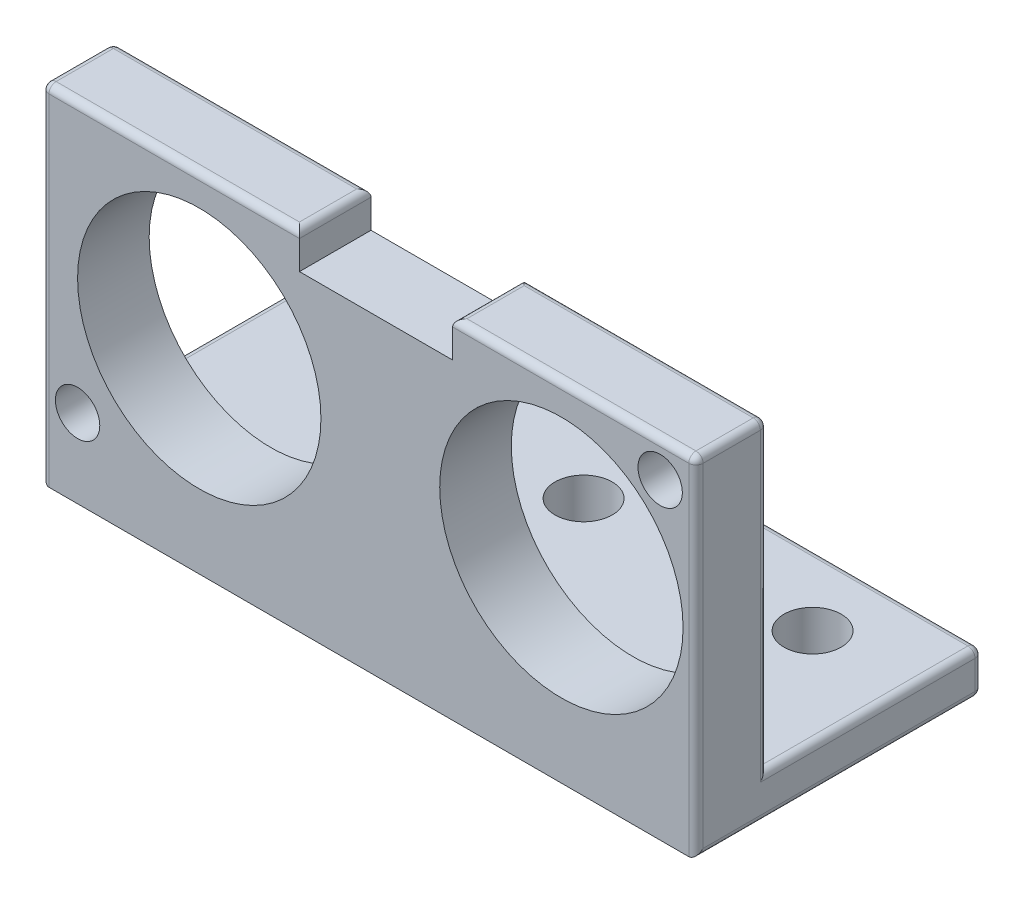
from build123d import *

# Parameters (mm, degrees)
SKETCH_1_W          = 45.7
SKETCH_1_H          = 21.3
EXTRUDE_1_DEPTH     = 5
SKETCH_2_R          = 1.55
SKETCH_2_R_2        = 8.5
CUT_EXTRUDE_1_DEPTH = 13.95
SKETCH_7_W          = 45.7
SKETCH_7_H          = 20
EXTRUDE_3_DEPTH     = 3
SKETCH_3_W          = 10.7
SKETCH_3_H          = 2.5
CUT_EXTRUDE_2_DEPTH = 13.95
FILLET_4_R          = 0.5
SKETCH_11_R         = 2
CUT_EXTRUDE_4_DEPTH = 3
FILLET_5_R          = 0.5


with BuildPart() as part:
    # 草圖1 → 填料-伸長1 (new body)
    with BuildSketch(Plane.XY):
        Rectangle(SKETCH_1_W, SKETCH_1_H)
    extrude(amount=EXTRUDE_1_DEPTH)

    # 草圖2 → 除料-伸長1 (cut)
    with BuildSketch(Plane.XY.offset(5)):
        with Locations((-20.35, -8.15)):
            Circle(SKETCH_2_R)
        with Locations((20.35, 8.15)):
            Circle(SKETCH_2_R)
        with Locations((-11.85, 0)):
            Circle(SKETCH_2_R_2)
        with Locations((13.45, 0)):
            Circle(SKETCH_2_R_2)
    extrude(amount=-CUT_EXTRUDE_1_DEPTH, mode=Mode.SUBTRACT)

    # 草圖7 → 填料-伸長3 (add)
    with BuildSketch(Plane.XZ.offset(10.65)):
        with Locations((0, -5)):
            Rectangle(SKETCH_7_W, SKETCH_7_H)
    extrude(amount=EXTRUDE_3_DEPTH)

    # 草圖3 → 除料-伸長2 (cut)
    with BuildSketch(Plane.XY.offset(5)):
        with Locations((0.5, 9.4)):
            Rectangle(SKETCH_3_W, SKETCH_3_H)
    extrude(amount=-CUT_EXTRUDE_2_DEPTH, mode=Mode.SUBTRACT)

    # 圓角4
    fillet_4_edges = [part.edges().sort_by_distance(p)[0] for p in [
        (14.35, 10.65, 5),
        (5.85, 10.65, 2.5),
        (14.35, 10.65, 0),
        (-13.85, 10.65, 0),
        (-4.85, 10.65, 2.5),
        (-13.85, 10.65, 5),
        (-22.85, 10.65, 2.5),
        (-22.85, -1.5, 5),
        (-22.85, -13.65, -5),
        (-22.85, -12.15, -15),
        (-22.85, -10.65, -7.5),
        (-22.85, 0, 0),
        (22.85, -10.65, -7.5),
        (22.85, -12.15, -15),
        (22.85, -13.65, -5),
        (22.85, -1.5, 5),
        (22.85, 10.65, 2.5),
        (22.85, 0, 0),
    ]]
    fillet(fillet_4_edges, radius=FILLET_4_R)

    # 草圖11 → 除料-伸長4 (cut)
    with BuildSketch(Plane(origin=(0, -10.65, 0), x_dir=(1, 0, 0), z_dir=(0, 1, 0))):
        with Locations(Location((0, 10, 0), (0, 0, 270))):
            Circle(SKETCH_11_R)
        with Locations(Location((16, 10, 0), (0, 0, 270))):
            Circle(SKETCH_11_R)
        with Locations(Location((-16, 10, 0), (0, 0, 270))):
            Circle(SKETCH_11_R)
    extrude(amount=-CUT_EXTRUDE_4_DEPTH, mode=Mode.SUBTRACT)

    # 圓角5
    # the kernel refuses this fillet: 0.5 mm, written as the material it takes off along each edge
    with BuildSketch(Plane(origin=(-22.35, -13.15, -14.5), x_dir=(0, 0, -1), z_dir=(0, -1, 0))) as fillet_5_piece_1_section:
        Polygon((0, 0), (FILLET_5_R, 0), (FILLET_5_R, -FILLET_5_R), (0, -FILLET_5_R), align=None)
    fillet_5_piece_1 = extrude(amount=FILLET_5_R, mode=Mode.PRIVATE)
    fillet_5_piece_1 = fillet_5_piece_1 - Plane(origin=(-22.35, -13.15, -14.5), x_dir=(0.7071067811865475, 0, 0.7071067811865475), z_dir=(0, -1, 0)) * Sphere(FILLET_5_R, mode=Mode.PRIVATE)
    add(fillet_5_piece_1, mode=Mode.SUBTRACT)
    with BuildSketch(Plane(origin=(-22.35, -11.15, -14.5), x_dir=(0, 0, -1), z_dir=(0, 1, 0))) as fillet_5_piece_2_section:
        Polygon((0, 0), (FILLET_5_R, 0), (FILLET_5_R, FILLET_5_R), (0, FILLET_5_R), align=None)
    fillet_5_piece_2 = extrude(amount=FILLET_5_R, mode=Mode.PRIVATE)
    fillet_5_piece_2 = fillet_5_piece_2 - Plane(origin=(-22.35, -11.15, -14.5), x_dir=(0.7071067811865475, 0, 0.7071067811865475), z_dir=(0, 1, 0)) * Sphere(FILLET_5_R, mode=Mode.PRIVATE)
    add(fillet_5_piece_2, mode=Mode.SUBTRACT)
    with BuildSketch(Plane(origin=(22.35, -11.15, -14.5), x_dir=(0, 0, -1), z_dir=(0, 1, 0))) as fillet_5_piece_3_section:
        Polygon((0, 0), (FILLET_5_R, 0), (FILLET_5_R, -FILLET_5_R), (0, -FILLET_5_R), align=None)
    fillet_5_piece_3 = extrude(amount=FILLET_5_R, mode=Mode.PRIVATE)
    fillet_5_piece_3 = fillet_5_piece_3 - Plane(origin=(22.35, -11.15, -14.5), x_dir=(-0.7071067811865475, 0, 0.7071067811865475), z_dir=(0, 1, 0)) * Sphere(FILLET_5_R, mode=Mode.PRIVATE)
    add(fillet_5_piece_3, mode=Mode.SUBTRACT)
    with BuildSketch(Plane(origin=(22.35, -13.15, -14.5), x_dir=(0, 0, -1), z_dir=(0, -1, 0))) as fillet_5_piece_4_section:
        Polygon((0, 0), (FILLET_5_R, 0), (FILLET_5_R, FILLET_5_R), (0, FILLET_5_R), align=None)
    fillet_5_piece_4 = extrude(amount=FILLET_5_R, mode=Mode.PRIVATE)
    fillet_5_piece_4 = fillet_5_piece_4 - Plane(origin=(22.35, -13.15, -14.5), x_dir=(-0.7071067811865475, 0, 0.7071067811865475), z_dir=(0, -1, 0)) * Sphere(FILLET_5_R, mode=Mode.PRIVATE)
    add(fillet_5_piece_4, mode=Mode.SUBTRACT)
    with BuildSketch(Plane(origin=(-22.35, -13.65, -15), x_dir=(0, 0, 1), z_dir=(1, 0, 0))) as fillet_5_piece_5:
        with BuildLine():
            CenterArc((FILLET_5_R, -FILLET_5_R), FILLET_5_R, 90, 90)
            Line((0, -FILLET_5_R), (0, 0))
            Line((0, 0), (FILLET_5_R, 0))
        make_face()
    extrude(amount=44.7, mode=Mode.SUBTRACT)
    with BuildSketch(Plane(origin=(-22.35, -10.65, -15), x_dir=(0, 0, 1), z_dir=(1, 0, 0))) as fillet_5_piece_6:
        with BuildLine():
            CenterArc((FILLET_5_R, FILLET_5_R), FILLET_5_R, 180, 90)
            Line((0, FILLET_5_R), (0, 0))
            Line((0, 0), (FILLET_5_R, 0))
        make_face()
    extrude(amount=44.7, mode=Mode.SUBTRACT)


solid = part.part
